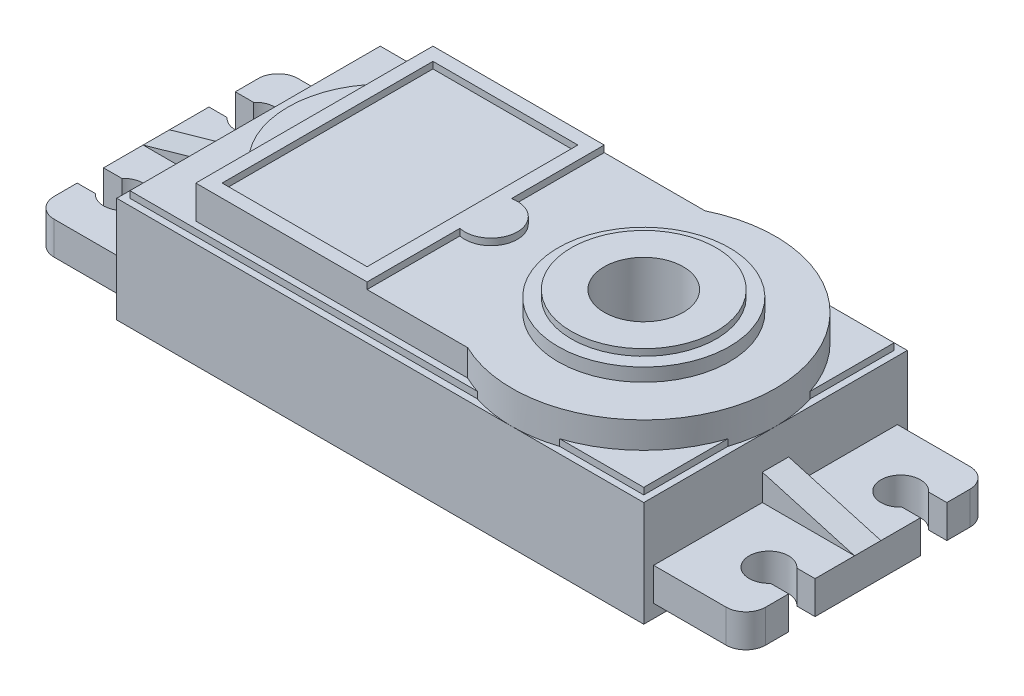
from build123d import *

# Parameters (mm, degrees)
SCHIZZO1_W                   = 40
SCHIZZO1_H                   = 20
ESTRUSIONE_ESTRUSIONE2_DEPTH = 8
TAGLIO_ESTRUSIONE4_DEPTH     = 6
ESTRUSIONE_ESTRUSIONE4_DEPTH = 2.5
SCHIZZO7_W                   = 39
SCHIZZO7_H                   = 19
ESTRUSIONE_ESTRUSIONE3_DEPTH = 0.5
SCHIZZO8_W                   = 11
SCHIZZO8_H                   = 16
ESTRUSIONE_ESTRUSIONE5_DEPTH = 0.5
SCHIZZO9_R                   = 6.5
ESTRUSIONE_ESTRUSIONE6_DEPTH = 1
SCHIZZO10_R                  = 5.5
ESTRUSIONE_ESTRUSIONE7_DEPTH = 0.5
SCHIZZO11_R                  = 3
TAGLIO_ESTRUSIONE5_DEPTH     = 26.377155081
SCHIZZO12_R                  = 1.5
ESTRUSIONE_ESTRUSIONE8_DEPTH = 2.5
TAGLIO_ESTRUSIONE6_DEPTH     = 31.020826105
SPECCHIA4_COPY_1_DEPTH       = 31.020826105
NERVATURA1_REACH             = 33.193
SCHIZZO16_WALL_W             = 71.666005732
SCHIZZO16_WALL_H             = 2


with BuildPart() as part:
    # Schizzo1 → Estrusione-Estrusione2 (new body)
    with BuildSketch(Plane(origin=(0, 0, 0), x_dir=(1, 0, 0), z_dir=(0, 1, 0))):
        Rectangle(SCHIZZO1_W, SCHIZZO1_H)
    extrude(amount=ESTRUSIONE_ESTRUSIONE2_DEPTH)

    # Schizzo2 → Taglio-Estrusione4 (cut)
    with BuildSketch(Plane(origin=(0, 0, 0), x_dir=(1, 0, 0), z_dir=(0, 1, 0))):
        Polygon((16, -8), (-16, -8), (-16, -6), (-18, -6), (-18, 6), (-16, 6), (-16, 8), (16, 8), (16, 6), (18, 6), (18, -6), (16, -6), align=None)
    extrude(amount=TAGLIO_ESTRUSIONE4_DEPTH, mode=Mode.SUBTRACT)

    # Schizzo3 → Foro per Vite M1-1 (revolve, cut)
    with BuildSketch(Plane(origin=(-18, 0, 8), x_dir=(0, 0, -1), z_dir=(1, 0, 0))):
        Polygon((0, 0), (0, 5.390559402), (0.65, 5), (0.65, 0.025), (0.675, 0), align=None)
    foro_per_vite_m1_1 = revolve(axis=Axis((-18, -6.35, 8), (0, 1, 0)), mode=Mode.SUBTRACT)

    # Specchia1: Foro per Vite M1-1 across plane
    add(foro_per_vite_m1_1.mirror(Plane(origin=(0, 0, 0), x_dir=(0, 0, 1), z_dir=(1, 0, 0))), mode=Mode.SUBTRACT)

    # Specchia2 copy 1 sketch → Specchia2 copy 1 (revolve, cut)
    with BuildSketch(Plane(origin=(18, 0, -8), x_dir=(0, 0, 1), z_dir=(-1, 0, 0))):
        Polygon((0, 0), (0, 5.390559402), (0.65, 5), (0.65, 0.025), (0.675, 0), align=None)
    revolve(axis=Axis((18, -6.35, -8), (0, 1, 0)), mode=Mode.SUBTRACT)

    # Specchia2 copy 2 sketch → Specchia2 copy 2 (revolve, cut)
    with BuildSketch(Plane(origin=(-18, 0, -8), x_dir=(0, 0, 1), z_dir=(1, 0, 0))):
        Polygon((0, 0), (0, -5.390559402), (0.65, -5), (0.65, -0.025), (0.675, 0), align=None)
    revolve(axis=Axis((-18, -6.35, -8), (0, -1, 0)), mode=Mode.SUBTRACT)

    # Taglia-Sweep3: sweep along a path in Schizzo5
    with BuildLine(Plane.XZ) as taglia_sweep3_path:
        Line((19, -9), (-19, -9))
        Line((-19, -9), (-19, 9))
        Line((-19, 9), (19, 9))
        Line((19, 9), (19, -9))
    # Schizzo4 → Taglia-Sweep3 (sweep, cut)
    with BuildSketch(Plane.XY):
        with BuildLine():
            Line((-19.25, 0), (-18.75, 0))
            ThreePointArc((-18.75, 0), (-19, 0.25), (-19.25, 0))
        make_face()
    sweep(path=taglia_sweep3_path.line, transition=Transition.RIGHT, mode=Mode.SUBTRACT)

    # Schizzo6 → Estrusione-Estrusione4 (add)
    with BuildSketch(Plane(origin=(0, 8, 0), x_dir=(1, 0, 0), z_dir=(0, 1, 0))):
        with BuildLine():
            Line((5.641101056, 9), (-15, 9))
            Line((-15, 9), (-15, 5))
            ThreePointArc((-15, 5), (-17, 0), (-15, -5))
            Line((-15, -5), (-15, -9))
            Line((-15, -9), (5.641101056, -9))
            ThreePointArc((5.641101056, -9), (20, 0), (5.641101056, 9))
        make_face()
    extrude(amount=ESTRUSIONE_ESTRUSIONE4_DEPTH)

    # Schizzo7 → Estrusione-Estrusione3 (add)
    with BuildSketch(Plane(origin=(0, 8, 0), x_dir=(1, 0, 0), z_dir=(0, 1, 0))):
        Rectangle(SCHIZZO7_W, SCHIZZO7_H)
    extrude(amount=ESTRUSIONE_ESTRUSIONE3_DEPTH)

    # Schizzo8 → Estrusione-Estrusione5 (add)
    with BuildSketch(Plane(origin=(0, 10.5, 0), x_dir=(1, 0, 0), z_dir=(0, 1, 0))):
        with BuildLine():
            Line((-15, 9), (-2, 9))
            Line((-2, 9), (-2, 1.957707578))
            ThreePointArc((-2, 1.957707578), (0.409122281, 0), (-2, -1.957707578))
            Line((-2, -1.957707578), (-2, -9))
            Line((-2, -9), (-15, -9))
            Line((-15, -9), (-15, 9))
        make_face()
        with Locations((-8.5, 0)):
            Rectangle(SCHIZZO8_W, SCHIZZO8_H, mode=Mode.SUBTRACT)
    extrude(amount=ESTRUSIONE_ESTRUSIONE5_DEPTH)

    # Schizzo9 → Estrusione-Estrusione6 (add)
    with BuildSketch(Plane(origin=(0, 10.5, 0), x_dir=(1, 0, 0), z_dir=(0, 1, 0))):
        with Locations((10, 0)):
            Circle(SCHIZZO9_R)
    extrude(amount=ESTRUSIONE_ESTRUSIONE6_DEPTH)

    # Schizzo10 → Estrusione-Estrusione7 (add)
    with BuildSketch(Plane(origin=(0, 11.5, 0), x_dir=(1, 0, 0), z_dir=(0, 1, 0))):
        with Locations((10, 0)):
            Circle(SCHIZZO10_R)
    extrude(amount=ESTRUSIONE_ESTRUSIONE7_DEPTH)

    # Schizzo11 → Taglio-Estrusione5 (cut, through all)
    with BuildSketch(Plane(origin=(0, 12, 0), x_dir=(1, 0, 0), z_dir=(0, 1, 0))):
        with Locations((10, 0)):
            Circle(SCHIZZO11_R)
    extrude(amount=-TAGLIO_ESTRUSIONE5_DEPTH, mode=Mode.SUBTRACT)

    # Schizzo12 → Estrusione-Estrusione8 (add)
    with BuildSketch(Plane(origin=(0, 1, 0), x_dir=(-1, 0, 0), z_dir=(0, -1, 0))):
        with BuildLine():
            Line((-25.5, 9.25), (-20, 9.25))
            Line((-20, 9.25), (-20, -9.25))
            Line((-20, -9.25), (-25.5, -9.25))
            ThreePointArc((-25.5, -9.25), (-26.560660172, -8.810660172), (-27, -7.75))
            Line((-27, -7.75), (-27, 7.75))
            ThreePointArc((-27, 7.75), (-26.560660172, 8.810660172), (-25.5, 9.25))
        make_face()
        with Locations((-24.5, 5)):
            Circle(SCHIZZO12_R, mode=Mode.SUBTRACT)
        with Locations((-24.5, -5)):
            Circle(SCHIZZO12_R, mode=Mode.SUBTRACT)
    estrusione_estrusione8 = extrude(amount=-ESTRUSIONE_ESTRUSIONE8_DEPTH)

    # Schizzo13 → Taglio-Estrusione6 (cut, through all)
    with BuildSketch(Plane(origin=(0, 3.5, 0), x_dir=(1, 0, 0), z_dir=(0, 1, 0))):
        with BuildLine():
            Line((25.618033989, 4), (34.322091749, 4))
            Line((34.322091749, 4), (34.322091749, 6))
            Line((34.322091749, 6), (25.618033989, 6))
            ThreePointArc((25.618033989, 6), (26, 5), (25.618033989, 4))
        make_face()
    taglio_estrusione6 = extrude(amount=-TAGLIO_ESTRUSIONE6_DEPTH, mode=Mode.SUBTRACT)

    # Specchia3: Taglio-Estrusione6 across plane
    add(taglio_estrusione6.mirror(Plane.XY), mode=Mode.SUBTRACT)

    # Specchia4: Estrusione-Estrusione8, Taglio-Estrusione6 across plane
    add(estrusione_estrusione8.mirror(Plane(origin=(0, 0, 0), x_dir=(0, 0, 1), z_dir=(1, 0, 0))))
    add(taglio_estrusione6.mirror(Plane(origin=(0, 0, 0), x_dir=(0, 0, 1), z_dir=(1, 0, 0))), mode=Mode.SUBTRACT)

    # Specchia4 copy 1 sketch → Specchia4 copy 1 (cut, through all)
    with BuildSketch(Plane(origin=(0, 3.5, 0), x_dir=(-1, 0, 0), z_dir=(0, 1, 0))):
        with BuildLine():
            Line((25.618033989, 4), (34.322091749, 4))
            Line((34.322091749, 4), (34.322091749, 6))
            Line((34.322091749, 6), (25.618033989, 6))
            ThreePointArc((25.618033989, 6), (26, 5), (25.618033989, 4))
        make_face()
    extrude(amount=-SPECCHIA4_COPY_1_DEPTH, mode=Mode.SUBTRACT)

    # Schizzo16 wall → Nervatura1 (add, up to next)
    with BuildSketch(Plane(origin=(23.5, 4.5, 0), x_dir=(-0.961523947641, 0.274721127897, 0), z_dir=(-0.274721127897, -0.961523947641, 0)), mode=Mode.PRIVATE) as nervatura1_sk1:
        Rectangle(SCHIZZO16_WALL_W, SCHIZZO16_WALL_H)
    nervatura1_tool1 = extrude(nervatura1_sk1.sketch, amount=NERVATURA1_REACH, mode=Mode.PRIVATE) - part.part
    nervatura1 = nervatura1_tool1.solids().sort_by_distance((23.5, 4.5, 0))[0]
    add(nervatura1)

    # Specchia5: Nervatura1 across plane
    add(nervatura1.mirror(Plane(origin=(0, 0, 0), x_dir=(0, 0, 1), z_dir=(1, 0, 0))))


solid = part.part
